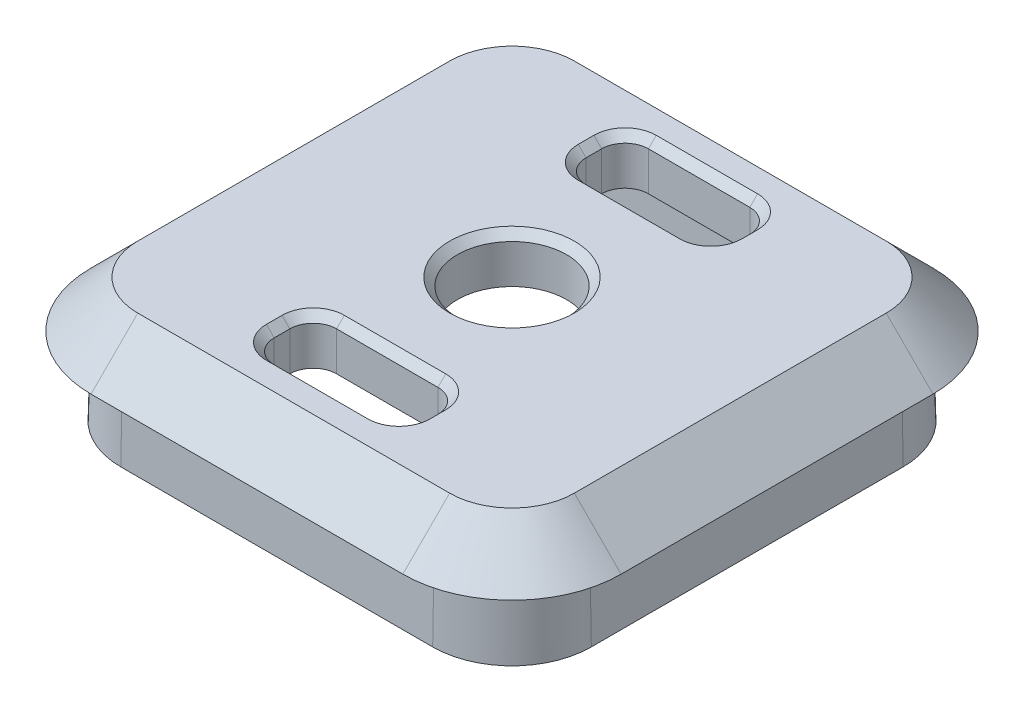
from build123d import *

# Parameters (mm, degrees)
CROQUIS1_W                 = 34
CROQUIS1_H                 = 34
SALIENTE_EXTRUIR1_DEPTH    = 3
REDONDEO1_R                = 7
CHAFL_N1_SIZE              = 3
CROQUIS2_W                 = 9.5
CROQUIS2_H                 = 4
CORTAR_EXTRUIR1_DEPTH      = 25.228082879
REDONDEO2_R                = 1.5
CHAFL_N2_SIZE              = 0.5
SALIENTE_EXTRUIR2_DEPTH    = 5
SALIENTE_EXTRUIR2_DRAFT    = -1
CROQUIS9_R                 = 3.5
CORTAR_EXTRUIR2_DEPTH      = 26.337718919
CHAFL_N3_SIZE              = 0.5
REDONDEO2_OF_SIMETR_A1_R   = 1.5
CHAFL_N2_OF_SIMETR_A1_SIZE = 0.5


with BuildPart() as part:
    # Croquis1 → Saliente-Extruir1 (new body)
    with BuildSketch(Plane(origin=(0, 0, 0), x_dir=(1, 0, 0), z_dir=(0, 1, 0))):
        Rectangle(CROQUIS1_W, CROQUIS1_H)
    extrude(amount=SALIENTE_EXTRUIR1_DEPTH)

    # Redondeo1
    redondeo1_edges = [part.edges().sort_by_distance(p)[0] for p in [
        (17, 1.5, 17),
        (-17, 1.5, 17),
        (-17, 1.5, -17),
        (17, 1.5, -17),
    ]]
    fillet(redondeo1_edges, radius=REDONDEO1_R)

    # Chaflán1
    chafl_n1_edges = [part.edges().sort_by_distance(p)[0] for p in [
        (17, 3, 0),
        (14.949747468, 3, -14.949747468),
        (14.949747468, 3, 14.949747468),
        (0, 3, -17),
        (0, 3, 17),
        (-14.949747468, 3, -14.949747468),
        (-14.949747468, 3, 14.949747468),
        (-17, 3, 0),
    ]]
    chamfer(chafl_n1_edges, length=CHAFL_N1_SIZE - 0.0001)  # a hair under: the kernel refuses the full size

    # Croquis2 → Cortar-Extruir1 (cut, through all)
    with BuildSketch(Plane(origin=(0, 3, 0), x_dir=(1, 0, 0), z_dir=(0, 1, 0))):
        with Locations((0, 10)):
            Rectangle(CROQUIS2_W, CROQUIS2_H)
    cortar_extruir1 = extrude(amount=-CORTAR_EXTRUIR1_DEPTH, mode=Mode.SUBTRACT)

    # Redondeo2
    redondeo2_edges = [part.edges().sort_by_distance(p)[0] for p in [
        (4.75, 1.5, -12),
        (4.75, 1.5, -8),
        (-4.75, 1.5, -8),
        (-4.75, 1.5, -12),
    ]]
    fillet(redondeo2_edges, radius=REDONDEO2_R)

    # Chaflán2
    chafl_n2_edges = [part.edges().sort_by_distance(p)[0] for p in [
        (0, 3, -8),
        (-4.75, 3, -10),
        (4.75, 3, -10),
        (0, 3, -12),
        (-4.310660172, 3, -8.439339828),
        (4.310660172, 3, -8.439339828),
        (4.310660172, 3, -11.560660172),
        (-4.310660172, 3, -11.560660172),
    ]]
    chamfer(chafl_n2_edges, length=CHAFL_N2_SIZE)


with BuildPart() as saliente_extruir2_tool:
    # Croquis8 → Saliente-Extruir2 (with draft: the straight prism first)
    with BuildSketch(Plane.XZ):
        with BuildLine():
            ThreePointArc((-10, 15), (-13.535533906, 13.535533906), (-15, 10))
            Line((-15, 10), (-15, -10))
            ThreePointArc((-15, -10), (-13.535533906, -13.535533906), (-10, -15))
            Line((-10, -15), (10, -15))
            ThreePointArc((10, -15), (13.535533906, -13.535533906), (15, -10))
            Line((15, -10), (15, 10))
            ThreePointArc((15, 10), (13.535533906, 13.535533906), (10, 15))
            Line((10, 15), (-10, 15))
        make_face()
        with BuildLine():
            Line((-13, 10), (-13, -10))
            ThreePointArc((-13, -10), (-12.121320344, -12.121320344), (-10, -13))
            Line((-10, -13), (10, -13))
            ThreePointArc((10, -13), (12.121320344, -12.121320344), (13, -10))
            Line((13, -10), (13, 10))
            ThreePointArc((13, 10), (12.121320344, 12.121320344), (10, 13))
            Line((10, 13), (-10, 13))
            ThreePointArc((-10, 13), (-12.121320344, 12.121320344), (-13, 10))
        make_face(mode=Mode.SUBTRACT)
    extrude(amount=SALIENTE_EXTRUIR2_DEPTH)
    # Saliente-Extruir2: the draft: its side faces are tilted about the plane it starts from
    saliente_extruir2_sides = [saliente_extruir2_tool.faces().sort_by_distance(p)[0] for p in [
        (0, -2.5, 15),
        (-13.535533906, -2.5, 13.535533906),
        (-15, -2.5, 0),
        (-13.535533906, -2.5, -13.535533906),
        (0, -2.5, -15),
        (13.535533906, -2.5, -13.535533906),
        (15, -2.5, 0),
        (13.535533906, -2.5, 13.535533906),
        (12.121320344, -2.5, 12.121320344),
        (13, -2.5, 0),
        (12.121320344, -2.5, -12.121320344),
        (0, -2.5, -13),
        (-12.121320344, -2.5, -12.121320344),
        (-13, -2.5, 0),
        (-12.121320344, -2.5, 12.121320344),
        (0, -2.5, 13),
    ]]
    draft(saliente_extruir2_sides, Plane.XZ, SALIENTE_EXTRUIR2_DRAFT)


with BuildPart() as part_1:
    add(part.part)

    # Saliente-Extruir2: add saliente_extruir2_tool
    add(saliente_extruir2_tool.part)

    # Croquis9 → Cortar-Extruir2 (cut, through all)
    with BuildSketch(Plane(origin=(0, 3, 0), x_dir=(1, 0, 0), z_dir=(0, 1, 0))):
        with Locations(Location((0, 0, 0), (0, 0, 270))):
            Circle(CROQUIS9_R)
    extrude(amount=-CORTAR_EXTRUIR2_DEPTH, mode=Mode.SUBTRACT)

    # Chaflán3
    chafl_n3_edges = [part_1.edges().sort_by_distance(p)[0] for p in [
        (0, 3, -3.5),
    ]]
    chamfer(chafl_n3_edges, length=CHAFL_N3_SIZE)

    # Simetría1: Cortar-Extruir1 across plane
    add(cortar_extruir1.mirror(Plane.XY), mode=Mode.SUBTRACT)

    # Redondeo2 of Simetría1
    redondeo2_of_simetr_a1_edges = [part_1.edges().sort_by_distance(p)[0] for p in [
        (4.75, 1.5, 12),
        (4.75, 1.5, 8),
        (-4.75, 1.5, 8),
        (-4.75, 1.5, 12),
    ]]
    fillet(redondeo2_of_simetr_a1_edges, radius=REDONDEO2_OF_SIMETR_A1_R)

    # Chaflán2 of Simetría1
    chafl_n2_of_simetr_a1_edges = [part_1.edges().sort_by_distance(p)[0] for p in [
        (0, 3, 8),
        (-4.75, 3, 10),
        (4.75, 3, 10),
        (0, 3, 12),
        (-4.310660172, 3, 8.439339828),
        (4.310660172, 3, 8.439339828),
        (4.310660172, 3, 11.560660172),
        (-4.310660172, 3, 11.560660172),
    ]]
    chamfer(chafl_n2_of_simetr_a1_edges, length=CHAFL_N2_OF_SIMETR_A1_SIZE)


solid = part_1.part
